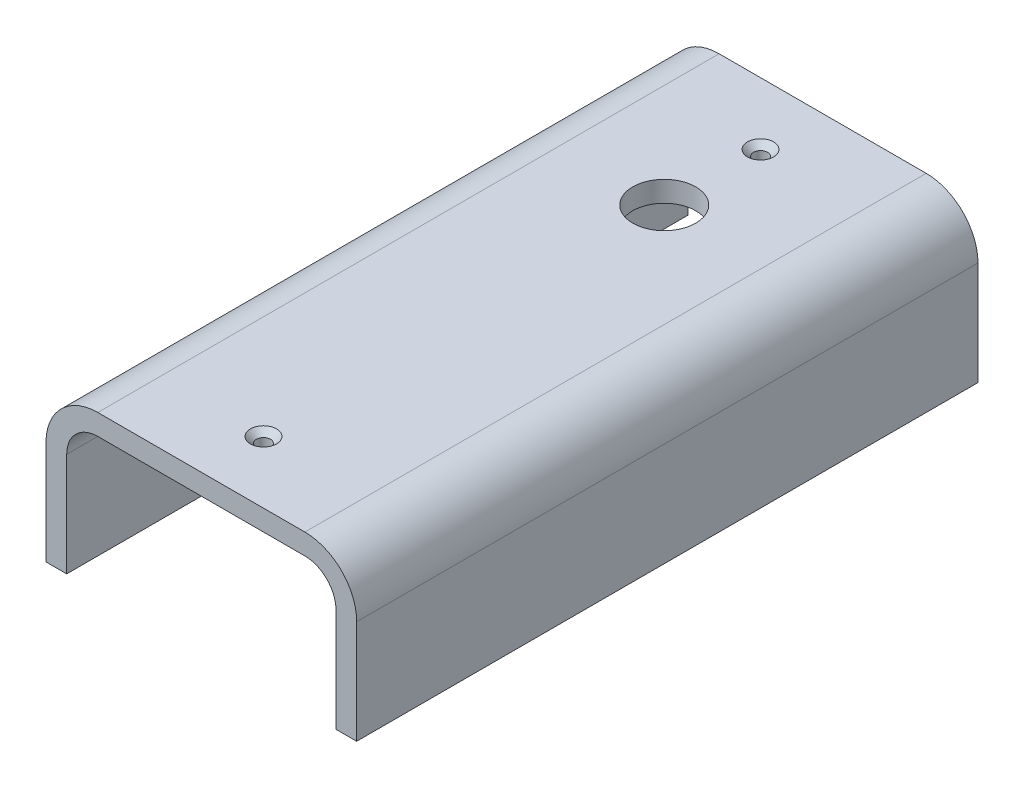
from build123d import *

# Parameters (mm, degrees)
BOSS_EXTRUDE1_DEPTH                             = 150
SKETCH2_R                                       = 1.5
CUT_EXTRUDE1_DEPTH                              = 160.099025767
SKETCH4_R                                       = 7.6
CUT_EXTRUDE2_DEPTH                              = 160.099025767
CSK_FOR_M3_FLAT_HEAD_MACHINE_SCREW1_D           = 3.4
CSK_FOR_M3_FLAT_HEAD_MACHINE_SCREW1_CSINK_D     = 6.3
CSK_FOR_M3_FLAT_HEAD_MACHINE_SCREW1_CSINK_ANGLE = 90


with BuildPart() as part:
    # Sketch1 → Boss-Extrude1 (new body)
    with BuildSketch(Plane(origin=(0, 0, 0), x_dir=(0, 1, 0), z_dir=(0, 0, 1))):
        with BuildLine():
            Line((-18.75, 37.5), (-18.75, 32.5))
            Line((-18.75, 32.5), (6.25, 32.5))
            ThreePointArc((6.25, 32.5), (11.553300859, 30.303300859), (13.75, 25))
            Line((13.75, 25), (13.75, -25))
            ThreePointArc((13.75, -25), (11.553300859, -30.303300859), (6.25, -32.5))
            Line((6.25, -32.5), (-18.75, -32.5))
            Line((-18.75, -32.5), (-18.75, -37.5))
            Line((-18.75, -37.5), (6.25, -37.5))
            ThreePointArc((6.25, -37.5), (15.088834765, -33.838834765), (18.75, -25))
            Line((18.75, -25), (18.75, 25))
            ThreePointArc((18.75, 25), (15.088834765, 33.838834765), (6.25, 37.5))
            Line((6.25, 37.5), (-18.75, 37.5))
        make_face()
    extrude(amount=BOSS_EXTRUDE1_DEPTH)

    # Sketch2 → Cut-Extrude1 (cut, through all)
    with BuildSketch(Plane(origin=(0, 18.75, 0), x_dir=(-1, 0, 0), z_dir=(0, 1, 0))):
        with Locations((0, 135)):
            Circle(SKETCH2_R)
        with Locations((0, 15)):
            Circle(SKETCH2_R)
    extrude(amount=-CUT_EXTRUDE1_DEPTH, mode=Mode.SUBTRACT)

    # Sketch4 → Cut-Extrude2 (cut, through all)
    with BuildSketch(Plane(origin=(0, 18.75, 0), x_dir=(-1, 0, 0), z_dir=(0, 1, 0))):
        with Locations((0, 38.25)):
            Circle(SKETCH4_R)
    extrude(amount=-CUT_EXTRUDE2_DEPTH, mode=Mode.SUBTRACT)

    # CSK for M3 Flat Head Machine Screw1 (through all)
    with Locations(Plane(origin=(0, 18.75, 135), x_dir=(0, 0, 1), z_dir=(0, 1, 0))):
        with Locations((0, 0), (-120, 0)):
            CounterSinkHole(CSK_FOR_M3_FLAT_HEAD_MACHINE_SCREW1_D / 2, CSK_FOR_M3_FLAT_HEAD_MACHINE_SCREW1_CSINK_D / 2, counter_sink_angle=CSK_FOR_M3_FLAT_HEAD_MACHINE_SCREW1_CSINK_ANGLE)


solid = part.part
